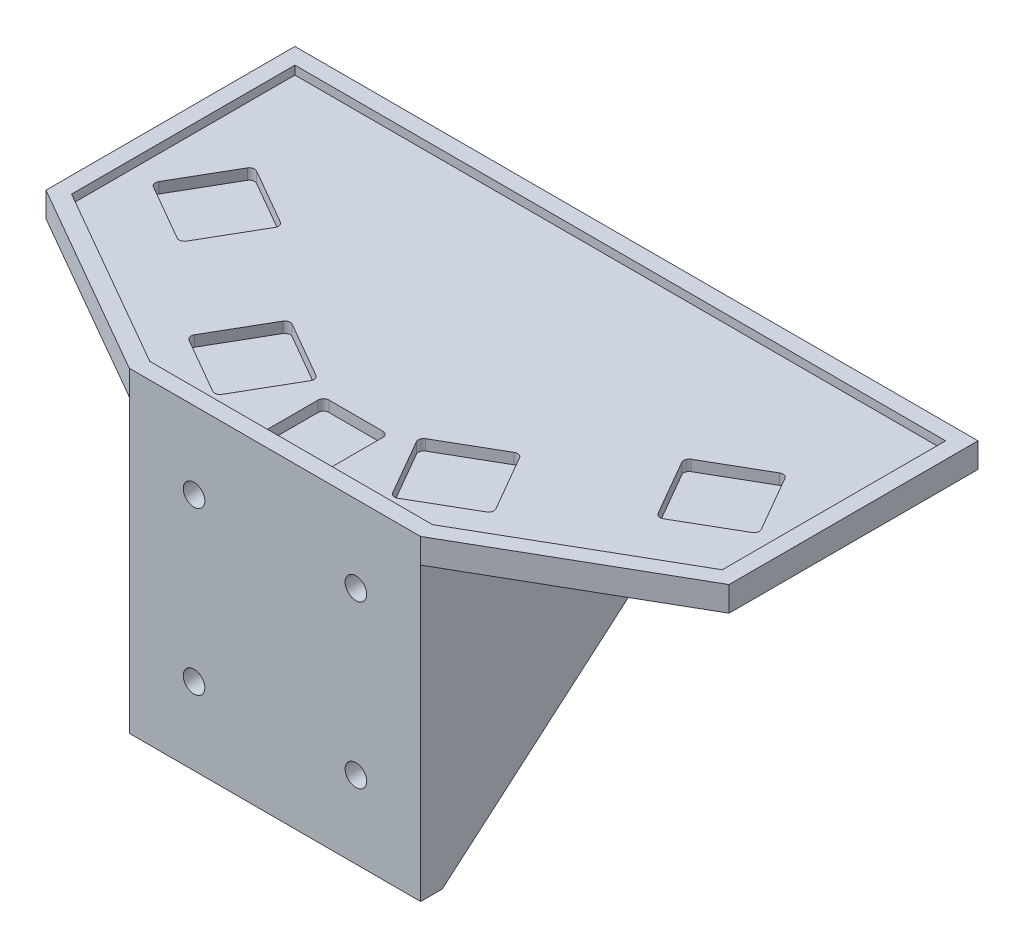
from build123d import *

# Parameters (mm, degrees)
EXTRUDE_1_DEPTH          = 1.6
EXTRUDE_2_DEPTH          = 3
SKETCH_3_W               = 12
SKETCH_3_H               = 12
CUT_EXTRUDE_1_DEPTH      = 2
FILLET_1_R               = 1
SKETCH_4_W               = 54.001491686
SKETCH_4_H               = 54.001491686
EXTRUDE_3_DEPTH          = 4
EXTRUDE_4_DEPTH          = 4
EXTRUDE_5_DEPTH          = 4
CUT_EXTRUDE_2_DEPTH      = 109.374628278
CUT_EXTRUDE_2_DEPTH_BACK = 109.374628278
SKETCH_7_R               = 2


with BuildPart() as part:
    # Эскиз1 → Бобышка-Вытянуть1 (new body)
    with BuildSketch(Plane(origin=(0, 0, 0), x_dir=(1, 0, 0), z_dir=(0, 1, 0))):
        Polygon((63.3, -43.135912567), (63.3, 3), (-63.3, 3), (-63.3, -43.135912567), (-27.000745843, -64), (27.000745843, -64), align=None)
        Polygon((-3, 0), (60.3, 0), (60.3, -41.4), (26.2, -61), (-3, -61), (-26.2, -61), (-60.3, -41.4), (-60.3, 0), align=None, mode=Mode.SUBTRACT)
    extrude(amount=EXTRUDE_1_DEPTH)

    # Эскиз2 → Бобышка-Вытянуть2 (add)
    with BuildSketch(Plane.XZ):
        Polygon((63.3, 43.135912567), (27.000745843, 64), (-27.000745843, 64), (-63.3, 43.135912567), (-63.3, -3), (63.3, -3), align=None)
    extrude(amount=EXTRUDE_2_DEPTH)

    # Эскиз3 → Вырез-Вытянуть1 (cut)
    with BuildSketch(Plane(origin=(0, 0, 0), x_dir=(1, 0, 0), z_dir=(0, 1, 0))):
        with Locations((0, -55)):
            Rectangle(SKETCH_3_W, SKETCH_3_H)
        Polygon((-21.436533479, -39.736860279), (-9.312177826, -46.736860279), (-16.312177826, -58.861215932), (-28.436533479, -51.861215932), align=None)
        Polygon((9.312177826, -46.736860279), (21.436533479, -39.736860279), (28.436533479, -51.861215932), (16.312177826, -58.861215932), align=None)
        Polygon((56.327549631, -30.562177826), (44.203193978, -37.562177826), (37.203193978, -25.437822174), (49.327549631, -18.437822174), align=None)
        Polygon((-44.203193978, -37.562177826), (-37.203193978, -25.437822174), (-49.327549631, -18.437822174), (-56.327549631, -30.562177826), align=None)
    extrude(amount=-CUT_EXTRUDE_1_DEPTH, mode=Mode.SUBTRACT)

    # Скругление1
    fillet_1_edges = [part.edges().sort_by_distance(p)[0] for p in [
        (44.203193978, -1, 37.562177826),
        (37.203193978, -1, 25.437822174),
        (49.327549631, -1, 18.437822174),
        (56.327549631, -1, 30.562177826),
        (28.436533479, -1, 51.861215932),
        (16.312177826, -1, 58.861215932),
        (9.312177826, -1, 46.736860279),
        (21.436533479, -1, 39.736860279),
        (-6, -1, 49),
        (6, -1, 49),
        (6, -1, 61),
        (-6, -1, 61),
        (-28.436533479, -1, 51.861215932),
        (-16.312177826, -1, 58.861215932),
        (-9.312177826, -1, 46.736860279),
        (-21.436533479, -1, 39.736860279),
        (-56.327549631, -1, 30.562177826),
        (-44.203193978, -1, 37.562177826),
        (-37.203193978, -1, 25.437822174),
        (-49.327549631, -1, 18.437822174),
    ]]
    fillet(fillet_1_edges, radius=FILLET_1_R)

    # Эскиз4 → Бобышка-Вытянуть3 (add)
    with BuildSketch(Plane.XY.offset(64)):
        with Locations((0, -30.000745843)):
            Rectangle(SKETCH_4_W, SKETCH_4_H)
    extrude(amount=-EXTRUDE_3_DEPTH)

    # Эскиз5 → Бобышка-Вытянуть4 (add)
    with BuildSketch(Plane.ZY.offset(27.000745843)):
        Polygon((60, -3), (-3, -3), (60, -57.001491686), align=None)
    extrude(amount=-EXTRUDE_4_DEPTH)

    # Эскиз6 → Бобышка-Вытянуть5 (add)
    with BuildSketch(Plane(origin=(27.000745843, 0, 0), x_dir=(0, 0, -1), z_dir=(1, 0, 0))):
        Polygon((3, -3), (-60, -3), (-60, -57.001491686), align=None)
    extrude(amount=-EXTRUDE_5_DEPTH)

    # Эскиз7 → Вырез-Вытянуть2 (cut, two sides: drawn at the far end of the back side and taken through both)
    with BuildSketch(Plane.XY.offset(64).offset(-CUT_EXTRUDE_2_DEPTH_BACK)):
        with Locations((-15, -12.700745843)):
            Circle(SKETCH_7_R)
        with Locations((15, -12.700745843)):
            Circle(SKETCH_7_R)
        with Locations((15, -42.700745843)):
            Circle(SKETCH_7_R)
        with Locations((-15, -42.700745843)):
            Circle(SKETCH_7_R)
    extrude(amount=CUT_EXTRUDE_2_DEPTH + CUT_EXTRUDE_2_DEPTH_BACK, mode=Mode.SUBTRACT)


solid = part.part
